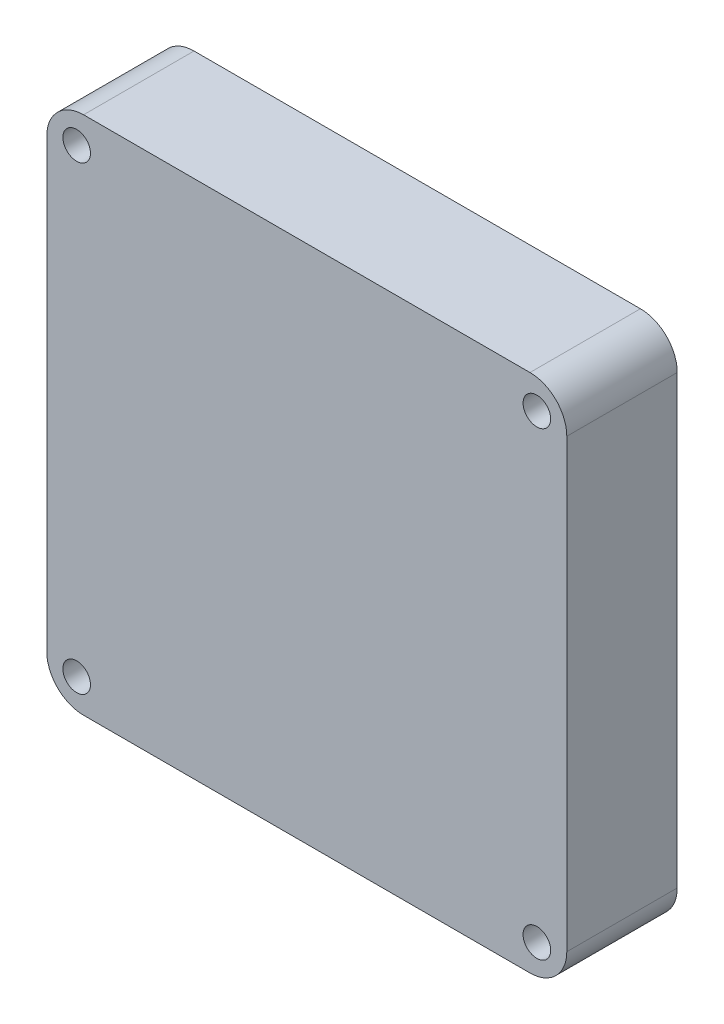
from build123d import *

# Parameters (mm, degrees)
SKETCH_1_W        = 56.5
SKETCH_1_H        = 56.5
SKETCH_1_R        = 1.5
EXTRUDE_448_DEPTH = 12
FILLET_1_R        = 4


with BuildPart() as part:
    # Эскиз1 → Extrude 448 (new body)
    with BuildSketch(Plane.XY):
        Rectangle(SKETCH_1_W, SKETCH_1_H)
        with Locations((-25, 25)):
            Circle(SKETCH_1_R, mode=Mode.SUBTRACT)
        with Locations((25, 25)):
            Circle(SKETCH_1_R, mode=Mode.SUBTRACT)
        with Locations((25, -25)):
            Circle(SKETCH_1_R, mode=Mode.SUBTRACT)
        with Locations((-25, -25)):
            Circle(SKETCH_1_R, mode=Mode.SUBTRACT)
    extrude(amount=EXTRUDE_448_DEPTH)

    # Скругление1
    fillet_1_edges = [part.edges().sort_by_distance(p)[0] for p in [
        (-28.25, -28.25, 6),
        (-28.25, 28.25, 6),
        (28.25, -28.25, 6),
        (28.25, 28.25, 6),
    ]]
    fillet(fillet_1_edges, radius=FILLET_1_R)


solid = part.part
